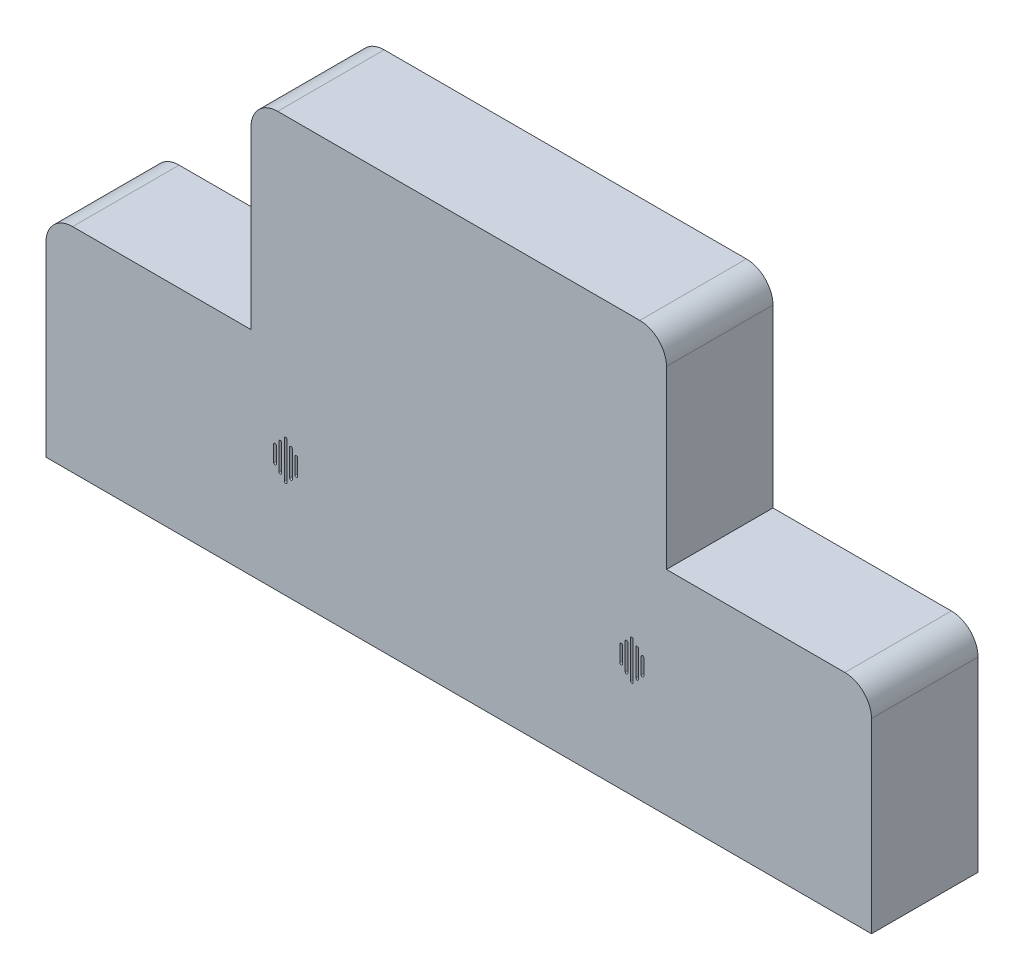
from build123d import *

# Parameters (mm, degrees)
SKETCH1_W           = 155
SKETCH1_H           = 20
BOSS_EXTRUDE1_DEPTH = 40
CUT_EXTRUDE1_DEPTH  = 3
SKETCH4_W           = 78
SKETCH4_H           = 38
BOSS_EXTRUDE2_DEPTH = 20
FILLET1_R           = 5
SHELL2_START        = -10
SHELL2_DEPTH        = 18
SHELL2_START_2      = 2
SHELL2_2_DEPTH      = 3
CUT_EXTRUDE3_DEPTH  = 112.759787043
CUT_EXTRUDE4_REACH  = 110.311
SKETCH8_R           = 8
SKETCH9_R           = 2.05
CUT_EXTRUDE5_DEPTH  = 1.1


with BuildPart() as part:
    # Sketch1 → Boss-Extrude1 (new body)
    with BuildSketch(Plane(origin=(0, 0, 0), x_dir=(1, 0, 0), z_dir=(0, 1, 0))):
        Rectangle(SKETCH1_W, SKETCH1_H)
    extrude(amount=BOSS_EXTRUDE1_DEPTH)

    # Sketch2 → Cut-Extrude1 (cut)
    with BuildSketch(Plane.XZ):
        with BuildLine():
            Line((-71, -8), (71, -8))
            ThreePointArc((71, -8), (74.535533906, -6.535533906), (76, -3))
            Line((76, -3), (76, 3))
            ThreePointArc((76, 3), (74.535533906, 6.535533906), (71, 8))
            Line((71, 8), (-71, 8))
            ThreePointArc((-71, 8), (-74.535533906, 6.535533906), (-76, 3))
            Line((-76, 3), (-76, -3))
            ThreePointArc((-76, -3), (-74.535533906, -6.535533906), (-71, -8))
        make_face()
    extrude(amount=-CUT_EXTRUDE1_DEPTH, mode=Mode.SUBTRACT)

    # Sketch4 → Boss-Extrude2 (add)
    with BuildSketch(Plane.XY.offset(10)):
        with Locations((0, 59)):
            Rectangle(SKETCH4_W, SKETCH4_H)
    extrude(amount=-BOSS_EXTRUDE2_DEPTH)

    # Fillet1
    fillet1_edges = [part.edges().sort_by_distance(p)[0] for p in [
        (-77.5, 40, 0),
        (77.5, 40, 0),
        (-39, 78, 0),
        (39, 78, 0),
    ]]
    fillet(fillet1_edges, radius=FILLET1_R)

    # Shell2: read off the stored shape, not the designer's step
    # Shell2 outline → Shell2 (cut)
    with BuildSketch(Plane.XY.offset(SHELL2_START)):
        with BuildLine():
            Line((-75.5, 35), (-75.5, 5))
            Line((-75.5, 5), (75.5, 5))
            Line((75.5, 5), (75.5, 35))
            ThreePointArc((75.5, 35), (74.621320344, 37.121320344), (72.5, 38))
            Line((72.5, 38), (37, 38))
            Line((37, 38), (37, 73))
            ThreePointArc((37, 73), (36.121320344, 75.121320344), (34, 76))
            Line((34, 76), (-34, 76))
            ThreePointArc((-34, 76), (-36.121320344, 75.121320344), (-37, 73))
            Line((-37, 73), (-37, 38))
            Line((-37, 38), (-72.5, 38))
            ThreePointArc((-72.5, 38), (-74.621320344, 37.121320344), (-75.5, 35))
        make_face()
    extrude(amount=SHELL2_DEPTH, mode=Mode.SUBTRACT)

    # Shell2 2 outline → Shell2 2 (cut)
    with BuildSketch(Plane(origin=(0, 0, 0), x_dir=(1, 0, 0), z_dir=(0, 1, 0)).offset(SHELL2_START_2)):
        with BuildLine():
            Line((75.5, 10), (71, 10))
            ThreePointArc((71, 10), (73.394439545, 9.577739678), (75.5, 8.361902647))
            Line((75.5, 8.361902647), (75.5, 10))
        make_face()
        with BuildLine():
            ThreePointArc((-75.5, 8.361902647), (-73.394439545, 9.577739678), (-71, 10))
            Line((-71, 10), (-75.5, 10))
            Line((-75.5, 10), (-75.5, 8.361902647))
        make_face()
    extrude(amount=SHELL2_2_DEPTH, mode=Mode.SUBTRACT)

    # Sketch7 → Cut-Extrude3 (cut, through all)
    with BuildSketch(Plane.XY.offset(10)):
        with BuildLine():
            Line((-32.75, 18.5), (-32.75, 25.5))
            ThreePointArc((-32.75, 25.5), (-32.5, 25.75), (-32.25, 25.5))
            Line((-32.25, 25.5), (-32.25, 18.5))
            ThreePointArc((-32.25, 18.5), (-32.5, 18.25), (-32.75, 18.5))
        make_face()
        with BuildLine():
            Line((-31.75, 19.5), (-31.75, 24.5))
            ThreePointArc((-31.75, 24.5), (-31.5, 24.75), (-31.25, 24.5))
            Line((-31.25, 24.5), (-31.25, 19.5))
            ThreePointArc((-31.25, 19.5), (-31.5, 19.25), (-31.75, 19.5))
        make_face()
        with BuildLine():
            Line((-30.75, 20.5), (-30.75, 23.5))
            ThreePointArc((-30.75, 23.5), (-30.5, 23.75), (-30.25, 23.5))
            Line((-30.25, 23.5), (-30.25, 20.5))
            ThreePointArc((-30.25, 20.5), (-30.5, 20.25), (-30.75, 20.5))
        make_face()
        with BuildLine():
            Line((-33.25, 19.5), (-33.25, 24.5))
            ThreePointArc((-33.25, 24.5), (-33.5, 24.75), (-33.75, 24.5))
            Line((-33.75, 24.5), (-33.75, 19.5))
            ThreePointArc((-33.75, 19.5), (-33.5, 19.25), (-33.25, 19.5))
        make_face()
        with BuildLine():
            Line((-34.25, 20.5), (-34.25, 23.5))
            ThreePointArc((-34.25, 23.5), (-34.5, 23.75), (-34.75, 23.5))
            Line((-34.75, 23.5), (-34.75, 20.5))
            ThreePointArc((-34.75, 20.5), (-34.5, 20.25), (-34.25, 20.5))
        make_face()
    cut_extrude3 = extrude(amount=-CUT_EXTRUDE3_DEPTH, mode=Mode.SUBTRACT)

    # Mirror1: Cut-Extrude3 across plane
    add(cut_extrude3.mirror(Plane(origin=(0, 0, 0), x_dir=(0, 0, 1), z_dir=(1, 0, 0))), mode=Mode.SUBTRACT)

    # Sketch8 → Cut-Extrude4 (cut, up to next)
    with BuildSketch(Plane.XZ.offset(-3), mode=Mode.PRIVATE) as cut_extrude4_sk1:
        with Locations(Location((0, 0, 0), (0, 0, 90))):
            Circle(SKETCH8_R)
    cut_extrude4_tool1 = extrude(cut_extrude4_sk1.sketch, amount=-CUT_EXTRUDE4_REACH, mode=Mode.PRIVATE) & part.part
    add(cut_extrude4_tool1.solids().sort_by_distance((0, 3, 0))[0], mode=Mode.SUBTRACT)

    # Sketch9 → Cut-Extrude5 (cut)
    with BuildSketch(Plane.XZ.offset(-3)):
        with Locations(Location((70.75, 2.75, 0), (0, 0, 270))):
            Circle(SKETCH9_R)
        with Locations(Location((66.25, 2.75, 0), (0, 0, 270))):
            Circle(SKETCH9_R)
        with Locations(Location((66.25, -2.75, 0), (0, 0, 270))):
            Circle(SKETCH9_R)
        with Locations(Location((70.75, -2.75, 0), (0, 0, 270))):
            Circle(SKETCH9_R)
    cut_extrude5 = extrude(amount=-CUT_EXTRUDE5_DEPTH, mode=Mode.SUBTRACT)

    # Mirror2: Cut-Extrude5 across plane
    add(cut_extrude5.mirror(Plane(origin=(0, 0, 0), x_dir=(0, 0, 1), z_dir=(1, 0, 0))), mode=Mode.SUBTRACT)


solid = part.part
